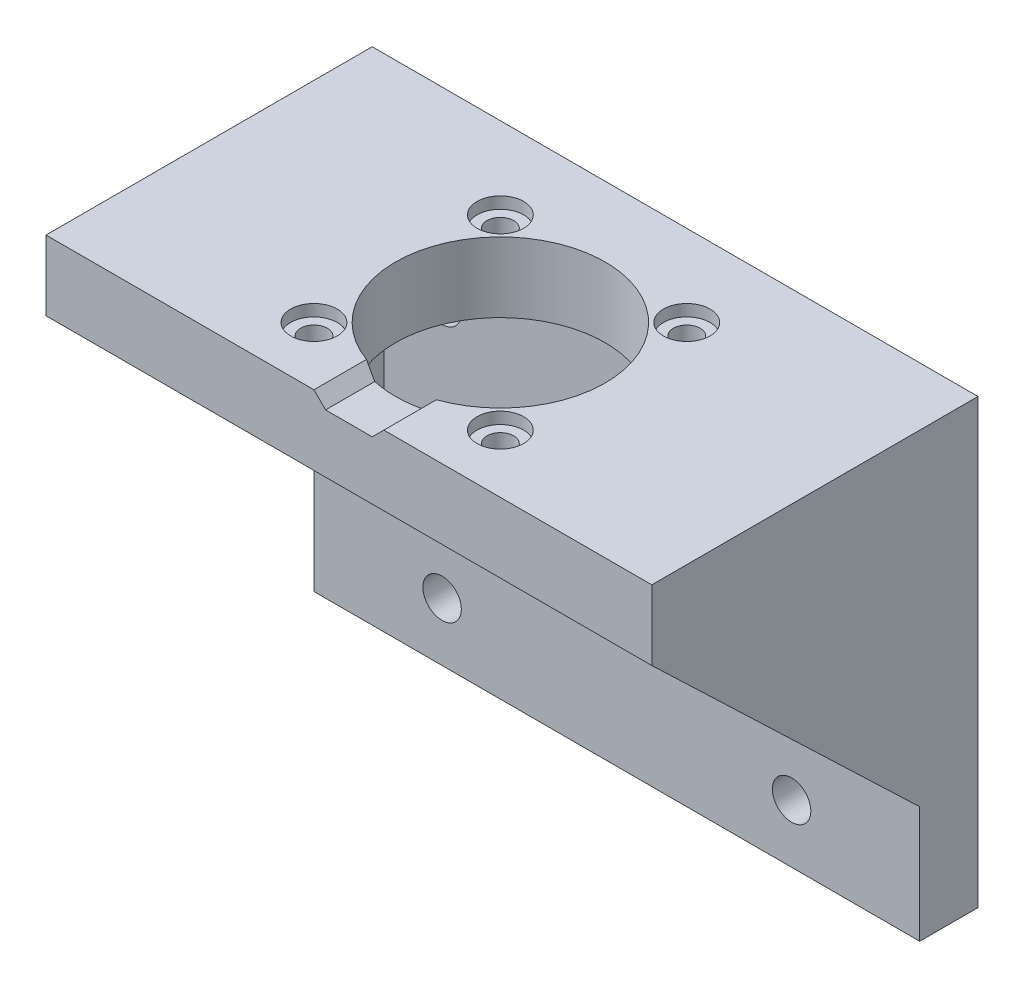
from build123d import *

# Parameters (mm, degrees)
SKETCH1_W           = 52
SKETCH1_H           = 38
BOSS_EXTRUDE1_DEPTH = 5
SKETCH2_W           = 52
SKETCH2_H           = 6
BOSS_EXTRUDE2_DEPTH = 23
SKETCH3_R           = 9
CUT_EXTRUDE1_DEPTH  = 6
SKETCH4_R           = 1.15
CUT_EXTRUDE2_DEPTH  = 6
SKETCH5_W           = 6
SKETCH5_H           = 32
BOSS_EXTRUDE3_DEPTH = 23
CUT_EXTRUDE3_DEPTH  = 136.306891562
SKETCH7_R           = 1.65
CUT_EXTRUDE4_DEPTH  = 5
SKETCH8_R           = 1.65
CUT_EXTRUDE5_DEPTH  = 5
SKETCH9_W           = 6
SKETCH9_H           = 4.814654703
CUT_EXTRUDE6_DEPTH  = 1
CHAMFER1_SIZE       = 1
SKETCH10_R          = 2
CUT_EXTRUDE7_DEPTH  = 1


with BuildPart() as part:
    # Sketch1 → Boss-Extrude1 (new body)
    with BuildSketch(Plane.XY):
        with Locations((-57.914180529, 102.737237131)):
            Rectangle(SKETCH1_W, SKETCH1_H)
    extrude(amount=BOSS_EXTRUDE1_DEPTH)

    # Sketch2 → Boss-Extrude2 (add)
    with BuildSketch(Plane.XY.offset(5)):
        with Locations((-57.914180529, 118.737237131)):
            Rectangle(SKETCH2_W, SKETCH2_H)
    extrude(amount=BOSS_EXTRUDE2_DEPTH)

    # Sketch3 → Cut-Extrude1 (cut)
    with BuildSketch(Plane(origin=(0, 121.737237131, 0), x_dir=(1, 0, 0), z_dir=(0, 1, 0))):
        with Locations(Location((-57.914080529, -15.0001, 0), (0, 0, 270))):
            Circle(SKETCH3_R)
    extrude(amount=-CUT_EXTRUDE1_DEPTH, mode=Mode.SUBTRACT)

    # Sketch4 → Cut-Extrude2 (cut)
    with BuildSketch(Plane.XZ.offset(-115.737237131)):
        with Locations(Location((-65.914080529, 23.0001, 0), (0, 0, 270))):
            Circle(SKETCH4_R)
        with Locations(Location((-49.914080529, 23.0001, 0), (0, 0, 270))):
            Circle(SKETCH4_R)
        with Locations(Location((-49.914080529, 7.0001, 0), (0, 0, 270))):
            Circle(SKETCH4_R)
        with Locations(Location((-65.914080529, 7.0001, 0), (0, 0, 270))):
            Circle(SKETCH4_R)
    extrude(amount=-CUT_EXTRUDE2_DEPTH, mode=Mode.SUBTRACT)

    # Sketch5 → Boss-Extrude3 (add)
    with BuildSketch(Plane.XY.offset(5)):
        with Locations((-80.914180529, 99.737237131)):
            Rectangle(SKETCH5_W, SKETCH5_H)
        with Locations((-34.914180529, 99.737237131)):
            Rectangle(SKETCH5_W, SKETCH5_H)
    extrude(amount=BOSS_EXTRUDE3_DEPTH)

    # Sketch6 → Cut-Extrude3 (cut, through all)
    with BuildSketch(Plane.ZY.offset(83.914180529)):
        Polygon((5, 83.737237131), (5, 93.737237131), (28, 115.737237131), (34.8001915, 115.737237131), (34.8001915, 79.151046586), (5, 79.151046586), align=None)
    extrude(amount=-CUT_EXTRUDE3_DEPTH, mode=Mode.SUBTRACT)

    # Sketch7 → Cut-Extrude4 (cut)
    with BuildSketch(Plane.XY.offset(5)):
        with Locations((-42.914180529, 110.737237131)):
            Circle(SKETCH7_R)
        with Locations((-42.914180529, 88.737237131)):
            Circle(SKETCH7_R)
        with Locations((-72.914180529, 110.737237131)):
            Circle(SKETCH7_R)
        with Locations((-72.914180529, 88.737237131)):
            Circle(SKETCH7_R)
    extrude(amount=-CUT_EXTRUDE4_DEPTH, mode=Mode.SUBTRACT)

    # Sketch8 → Cut-Extrude5 (cut)
    with BuildSketch(Plane.XY.offset(5)):
        with Locations((-72.914180529, 99.737237131)):
            Circle(SKETCH8_R)
        with Locations((-42.914180529, 99.737237131)):
            Circle(SKETCH8_R)
    extrude(amount=-CUT_EXTRUDE5_DEPTH, mode=Mode.SUBTRACT)

    # Sketch9 → Cut-Extrude6 (cut)
    with BuildSketch(Plane(origin=(0, 121.737237131, 0), x_dir=(1, 0, 0), z_dir=(0, 1, 0))):
        with Locations((-57.914180529, -25.592672648)):
            Rectangle(SKETCH9_W, SKETCH9_H)
    extrude(amount=-CUT_EXTRUDE6_DEPTH, mode=Mode.SUBTRACT)

    # Chamfer1
    chamfer1_edges = [part.edges().sort_by_distance(p)[0] for p in [
        (-60.914180529, 120.737237131, 25.742673009),
        (-54.914180529, 120.737237131, 25.742708364),
    ]]
    chamfer(chamfer1_edges, length=CHAMFER1_SIZE - 0.0001)  # a hair under: the kernel refuses the full size

    # Sketch10 → Cut-Extrude7 (cut)
    with BuildSketch(Plane(origin=(0, 121.737237131, 0), x_dir=(1, 0, 0), z_dir=(0, 1, 0))):
        with Locations(Location((-65.914080529, -7.0001, 0), (0, 0, 270))):
            Circle(SKETCH10_R)
        with Locations(Location((-49.914080529, -7.0001, 0), (0, 0, 270))):
            Circle(SKETCH10_R)
        with Locations(Location((-49.914080529, -23.0001, 0), (0, 0, 270))):
            Circle(SKETCH10_R)
        with Locations(Location((-65.914080529, -23.0001, 0), (0, 0, 270))):
            Circle(SKETCH10_R)
    extrude(amount=-CUT_EXTRUDE7_DEPTH, mode=Mode.SUBTRACT)


solid = part.part
